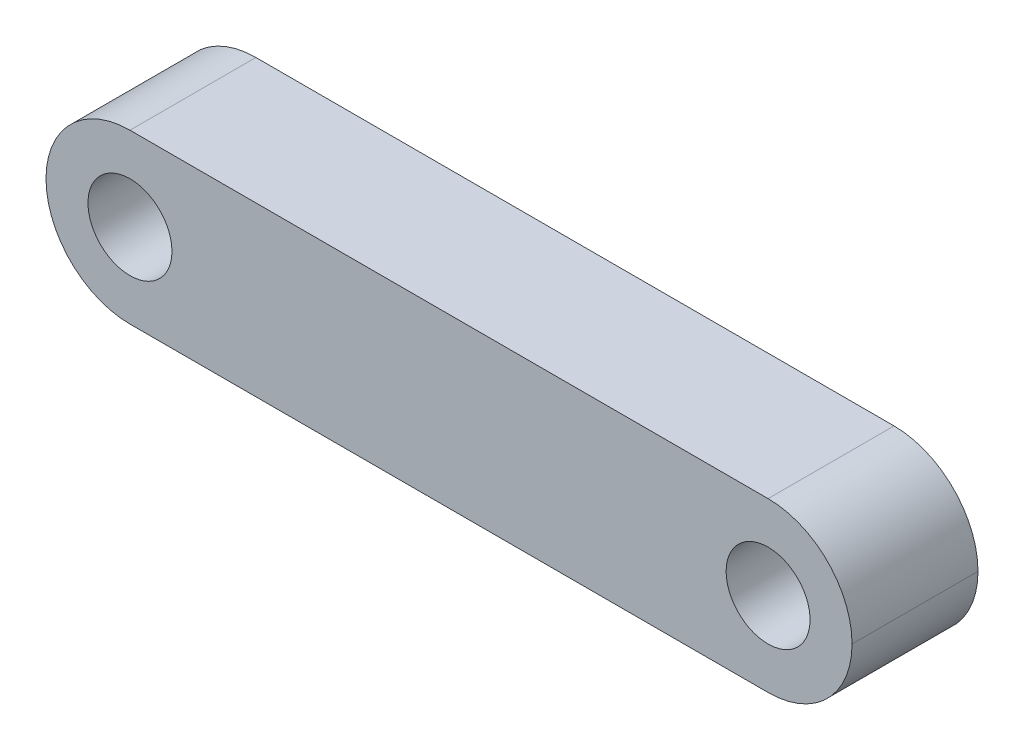
from build123d import *

# Parameters (mm, degrees)
IZIM1_W                     = 192
IZIM1_H                     = 40
IZIM1_R                     = 10
Y_KSEKLIK_EKSTR_ZYON1_DEPTH = 15
RADYUS1_R                   = 20


with BuildPart() as part:
    # Çizim1 → Yükseklik-Ekstrüzyon1 (new, symmetric)
    with BuildSketch(Plane.XY):
        Rectangle(IZIM1_W, IZIM1_H)
        with Locations((-76, 0)):
            Circle(IZIM1_R, mode=Mode.SUBTRACT)
        with Locations(Location((76, 0, 0), (0, 0, 180))):
            Circle(IZIM1_R, mode=Mode.SUBTRACT)
    extrude(amount=Y_KSEKLIK_EKSTR_ZYON1_DEPTH, both=True)

    # Radyus1
    radyus1_edges = [part.edges().sort_by_distance(p)[0] for p in [
        (-96, -20, 0),
        (-96, 20, 0),
        (96, -20, 0),
        (96, 20, 0),
    ]]
    fillet(radyus1_edges, radius=RADYUS1_R - 0.0001)  # a hair under: the kernel refuses the full size


solid = part.part
